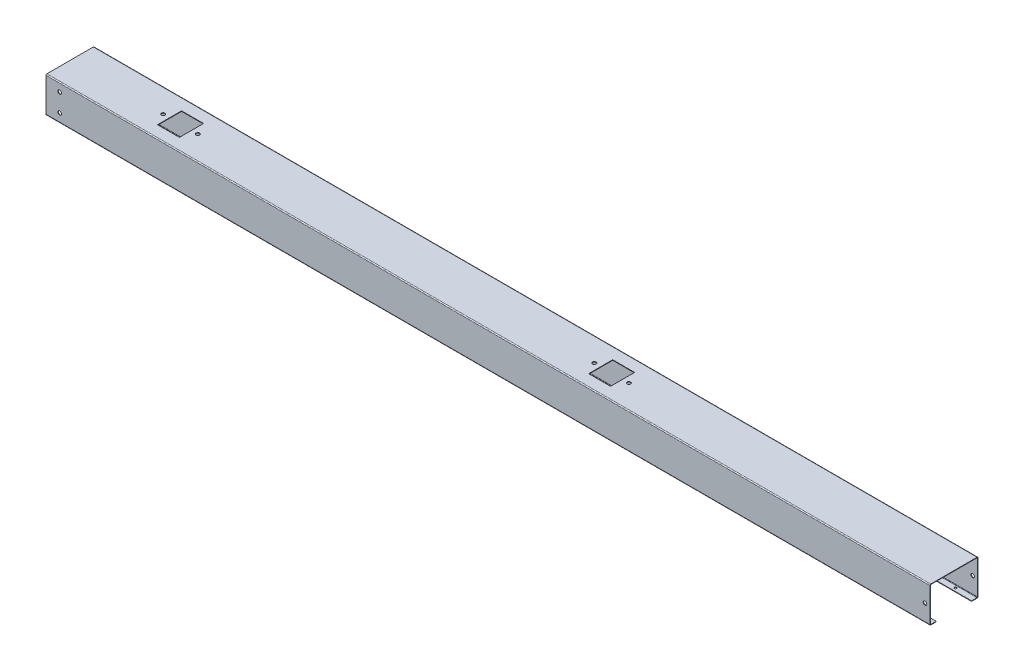
from build123d import *

# Parameters (mm, degrees)
SKETCH1_W                      = 1397
SKETCH1_H                      = 76.2
BASE_FLANGE1_DEPTH             = 0.75946
CUT_EXTRUDE1_DEPTH             = 10
SKETCH7_R                      = 2.8194
CUT_EXTRUDE2_DEPTH             = 10
EDGE_FLANGE1_STRIP_W           = 4.51104
EDGE_FLANGE1_STRIP_H           = 0.75946
EDGE_FLANGE1_STRIP_CUT_DEPTH   = 1397
EDGE_FLANGE1_STRIP_2_W         = 4.51104
EDGE_FLANGE1_STRIP_2_H         = 0.75946
EDGE_FLANGE1_STRIP_CUT_2_DEPTH = 1397
EDGE_FLANGE1_DEPTH             = 1397
EDGE_FLANGE1_BEND_DEPTH        = 1397
CUT_EXTRUDE5_DEPTH             = 831.856635277
CUT_EXTRUDE5_DEPTH_BACK        = 831.856635277
SKETCH43_R                     = 2.8194
EDGE_FLANGE5_STRIP_W           = 4.51104
EDGE_FLANGE5_STRIP_H           = 0.75946
EDGE_FLANGE5_STRIP_CUT_DEPTH   = 1397
EDGE_FLANGE5_STRIP_2_W         = 4.51104
EDGE_FLANGE5_STRIP_2_H         = 0.75946
EDGE_FLANGE5_STRIP_CUT_2_DEPTH = 1397
EDGE_FLANGE5_DEPTH             = 1397
EDGE_FLANGE5_BEND_DEPTH        = 1397
CUT_EXTRUDE6_REACH             = 830.283
SKETCH133_R                    = 1.651
CUT_EXTRUDE6_DIRECTION_2_DEPTH = 829.282923162
CUT_EXTRUDE7_DEPTH             = 831.907594623
CUT_EXTRUDE7_DEPTH_BACK        = 831.907594623
SKETCH134_R                    = 2.8194


# Sheet-metal steps are written as plain solids
with BuildPart() as part:
    # Sketch1 → Base-Flange1 (new body)
    with BuildSketch(Plane(origin=(0, 0, 0), x_dir=(1, 0, 0), z_dir=(0, 1, 0))):
        with Locations((127, 0)):
            Rectangle(SKETCH1_W, SKETCH1_H)
    extrude(amount=-BASE_FLANGE1_DEPTH)

    # Sketch6 → Cut-Extrude1 (cut)
    with BuildSketch(Plane(origin=(0, 0, 0), x_dir=(1, 0, 0), z_dir=(0, 1, 0))):
        Polygon((-414.3375, -19.05), (-390.7165, -19.05), (-379.6665, -19.05), (-379.6665, 19.05), (-390.7165, 19.05), (-414.3375, 19.05), align=None)
        Polygon((267.1445, -19.05), (290.7655, -19.05), (301.8155, -19.05), (301.8155, 19.05), (290.7655, 19.05), (267.1445, 19.05), align=None)
    extrude(amount=-CUT_EXTRUDE1_DEPTH, mode=Mode.SUBTRACT)

    # Sketch7 → Cut-Extrude2 (cut)
    with BuildSketch(Plane(origin=(0, 0, 0), x_dir=(1, 0, 0), z_dir=(0, 1, 0))):
        with Locations(Location((-424.3375054, 0, 0), (0, 0, 270))):
            Circle(SKETCH7_R)
        with Locations(Location((-369.6664946, 0, 0), (0, 0, 270))):
            Circle(SKETCH7_R)
        with Locations(Location((257.1444946, 0, 0), (0, 0, 270))):
            Circle(SKETCH7_R)
        with Locations(Location((311.8155054, 0, 0), (0, 0, 270))):
            Circle(SKETCH7_R)
    extrude(amount=-CUT_EXTRUDE2_DEPTH, mode=Mode.SUBTRACT)

    # Edge-Flange1 strip (across the edge) → Edge-Flange1 strip cut (cut)
    with BuildSketch(Plane(origin=(-571.5, -0.75946, -38.1), x_dir=(0, 0, 1), z_dir=(1, 0, 0))):
        with Locations((-0.75946, -0.37973)):
            Rectangle(EDGE_FLANGE1_STRIP_W, EDGE_FLANGE1_STRIP_H)
    extrude(amount=EDGE_FLANGE1_STRIP_CUT_DEPTH, mode=Mode.SUBTRACT)

    # Edge-Flange1 strip 2 (across the edge) → Edge-Flange1 strip cut 2 (cut)
    with BuildSketch(Plane(origin=(825.5, -0.75946, 38.1), x_dir=(0, 0, -1), z_dir=(-1, 0, 0))):
        with Locations((-0.75946, -0.37973)):
            Rectangle(EDGE_FLANGE1_STRIP_2_W, EDGE_FLANGE1_STRIP_2_H)
    extrude(amount=EDGE_FLANGE1_STRIP_CUT_2_DEPTH, mode=Mode.SUBTRACT)

    # Edge-Flange1 section (across the edge) → Edge-Flange1 (add)
    with BuildSketch(Plane(origin=(-571.5, -0.75946, -38.1), x_dir=(0, 0, 1), z_dir=(1, 0, 0))):
        with BuildLine():
            Line((0, 0.7366), (0, 54.61254))
            Line((0, 54.61254), (0.75946, 54.61254))
            Line((0.75946, 54.61254), (0.75946, 0.7366))
            ThreePointArc((0.75946, 0.7366), (0.975205145, 0.215745145), (1.49606, 0))
            Line((1.49606, 0), (1.49606, -0.75946))
            ThreePointArc((1.49606, -0.75946), (0.438185829, -0.321274171), (0, 0.7366))
        make_face()
    extrude(amount=EDGE_FLANGE1_DEPTH)

    # Edge-Flange1 section 2 (across the edge) → Edge-Flange1 bend (add)
    with BuildSketch(Plane(origin=(825.5, -0.75946, 38.1), x_dir=(0, 0, -1), z_dir=(-1, 0, 0))):
        with BuildLine():
            Line((0, 0.7366), (0, 54.61254))
            Line((0, 54.61254), (0.75946, 54.61254))
            Line((0.75946, 54.61254), (0.75946, 0.7366))
            ThreePointArc((0.75946, 0.7366), (0.975205145, 0.215745145), (1.49606, 0))
            Line((1.49606, 0), (1.49606, -0.75946))
            ThreePointArc((1.49606, -0.75946), (0.438185829, -0.321274171), (0, 0.7366))
        make_face()
    extrude(amount=EDGE_FLANGE1_BEND_DEPTH)

    # Sketch43 → Cut-Extrude5 (cut, two sides: drawn at the far end of the back side and taken through both)
    with BuildSketch(Plane(origin=(0, 0, -38.1), x_dir=(-1, 0, 0), z_dir=(0, 0, -1)).offset(-CUT_EXTRUDE5_DEPTH_BACK)):
        with Locations(Location((549.91, -13.44803, 0), (0, 0, 90))):
            Circle(SKETCH43_R)
        with Locations(Location((549.91, -42.164, 0), (0, 0, 90))):
            Circle(SKETCH43_R)
    extrude(amount=CUT_EXTRUDE5_DEPTH + CUT_EXTRUDE5_DEPTH_BACK, mode=Mode.SUBTRACT)

    # Edge-Flange5 strip (across the edge) → Edge-Flange5 strip cut (cut)
    with BuildSketch(Plane(origin=(825.5, -55.372, 37.34054), x_dir=(0, 1, 0), z_dir=(-1, 0, 0))):
        with Locations((-1.51892, -0.37973)):
            Rectangle(EDGE_FLANGE5_STRIP_W, EDGE_FLANGE5_STRIP_H)
    extrude(amount=EDGE_FLANGE5_STRIP_CUT_DEPTH, mode=Mode.SUBTRACT)

    # Edge-Flange5 strip 2 (across the edge) → Edge-Flange5 strip cut 2 (cut)
    with BuildSketch(Plane(origin=(-571.5, -55.372, -37.34054), x_dir=(0, 1, 0), z_dir=(1, 0, 0))):
        with Locations((-1.51892, -0.37973)):
            Rectangle(EDGE_FLANGE5_STRIP_2_W, EDGE_FLANGE5_STRIP_2_H)
    extrude(amount=EDGE_FLANGE5_STRIP_CUT_2_DEPTH, mode=Mode.SUBTRACT)

    # Edge-Flange5 section (across the edge) → Edge-Flange5 (add)
    with BuildSketch(Plane(origin=(825.5, -55.372, 37.34054), x_dir=(0, 1, 0), z_dir=(-1, 0, 0))):
        with BuildLine():
            Line((-0.75946, 0.7366), (-0.75946, 9.40054))
            Line((-0.75946, 9.40054), (0, 9.40054))
            Line((0, 9.40054), (0, 0.7366))
            ThreePointArc((0, 0.7366), (0.215745145, 0.215745145), (0.7366, 0))
            Line((0.7366, 0), (0.7366, -0.75946))
            ThreePointArc((0.7366, -0.75946), (-0.321274171, -0.321274171), (-0.75946, 0.7366))
        make_face()
    extrude(amount=EDGE_FLANGE5_DEPTH)

    # Edge-Flange5 section 2 (across the edge) → Edge-Flange5 bend (add)
    with BuildSketch(Plane(origin=(-571.5, -55.372, -37.34054), x_dir=(0, 1, 0), z_dir=(1, 0, 0))):
        with BuildLine():
            Line((-0.75946, 0.7366), (-0.75946, 9.40054))
            Line((-0.75946, 9.40054), (0, 9.40054))
            Line((0, 9.40054), (0, 0.7366))
            ThreePointArc((0, 0.7366), (0.215745145, 0.215745145), (0.7366, 0))
            Line((0.7366, 0), (0.7366, -0.75946))
            ThreePointArc((0.7366, -0.75946), (-0.321274171, -0.321274171), (-0.75946, 0.7366))
        make_face()
    extrude(amount=EDGE_FLANGE5_BEND_DEPTH)

    # Sketch133 → Cut-Extrude6 (cut, up to next)
    with BuildSketch(Plane.XZ.offset(56.13146), mode=Mode.PRIVATE) as cut_extrude6_sk1:
        with Locations(Location((698.5, -32.79394, 0), (0, 0, 90))):
            Circle(SKETCH133_R)
    cut_extrude6_tool1 = extrude(cut_extrude6_sk1.sketch, amount=-CUT_EXTRUDE6_REACH, mode=Mode.PRIVATE) & part.part
    # Sketch133 → Cut-Extrude6 (cut, up to next)
    with BuildSketch(Plane.XZ.offset(56.13146), mode=Mode.PRIVATE) as cut_extrude6_sk2:
        with Locations(Location((698.5, 32.79394, 0), (0, 0, 90))):
            Circle(SKETCH133_R)
    cut_extrude6_tool2 = extrude(cut_extrude6_sk2.sketch, amount=-CUT_EXTRUDE6_REACH, mode=Mode.PRIVATE) & part.part
    # Sketch133 → Cut-Extrude6 (cut, up to next)
    with BuildSketch(Plane.XZ.offset(56.13146), mode=Mode.PRIVATE) as cut_extrude6_sk3:
        with Locations(Location((201.93, 32.79394, 0), (0, 0, 90))):
            Circle(SKETCH133_R)
    cut_extrude6_tool3 = extrude(cut_extrude6_sk3.sketch, amount=-CUT_EXTRUDE6_REACH, mode=Mode.PRIVATE) & part.part
    # Sketch133 → Cut-Extrude6 (cut, up to next)
    with BuildSketch(Plane.XZ.offset(56.13146), mode=Mode.PRIVATE) as cut_extrude6_sk4:
        with Locations(Location((201.93, -32.79394, 0), (0, 0, 90))):
            Circle(SKETCH133_R)
    cut_extrude6_tool4 = extrude(cut_extrude6_sk4.sketch, amount=-CUT_EXTRUDE6_REACH, mode=Mode.PRIVATE) & part.part
    # Sketch133 → Cut-Extrude6 (cut, up to next)
    with BuildSketch(Plane.XZ.offset(56.13146), mode=Mode.PRIVATE) as cut_extrude6_sk5:
        with Locations(Location((-238.76, -32.79394, 0), (0, 0, 90))):
            Circle(SKETCH133_R)
    cut_extrude6_tool5 = extrude(cut_extrude6_sk5.sketch, amount=-CUT_EXTRUDE6_REACH, mode=Mode.PRIVATE) & part.part
    # Sketch133 → Cut-Extrude6 (cut, up to next)
    with BuildSketch(Plane.XZ.offset(56.13146), mode=Mode.PRIVATE) as cut_extrude6_sk6:
        with Locations(Location((-238.76, 32.79394, 0), (0, 0, 90))):
            Circle(SKETCH133_R)
    cut_extrude6_tool6 = extrude(cut_extrude6_sk6.sketch, amount=-CUT_EXTRUDE6_REACH, mode=Mode.PRIVATE) & part.part
    # Sketch133 → Cut-Extrude6 (cut, up to next)
    with BuildSketch(Plane.XZ.offset(56.13146), mode=Mode.PRIVATE) as cut_extrude6_sk7:
        with Locations(Location((-467.36, 32.79394, 0), (0, 0, 90))):
            Circle(SKETCH133_R)
    cut_extrude6_tool7 = extrude(cut_extrude6_sk7.sketch, amount=-CUT_EXTRUDE6_REACH, mode=Mode.PRIVATE) & part.part
    # Sketch133 → Cut-Extrude6 (cut, up to next)
    with BuildSketch(Plane.XZ.offset(56.13146), mode=Mode.PRIVATE) as cut_extrude6_sk8:
        with Locations(Location((-467.36, -32.79394, 0), (0, 0, 90))):
            Circle(SKETCH133_R)
    cut_extrude6_tool8 = extrude(cut_extrude6_sk8.sketch, amount=-CUT_EXTRUDE6_REACH, mode=Mode.PRIVATE) & part.part
    # Sketch133 → Cut-Extrude6 (cut, up to next)
    with BuildSketch(Plane.XZ.offset(56.13146), mode=Mode.PRIVATE) as cut_extrude6_sk9:
        with Locations(Location((-535.94, 32.79394, 0), (0, 0, 90))):
            Circle(SKETCH133_R)
    cut_extrude6_tool9 = extrude(cut_extrude6_sk9.sketch, amount=-CUT_EXTRUDE6_REACH, mode=Mode.PRIVATE) & part.part
    # Sketch133 → Cut-Extrude6 (cut, up to next)
    with BuildSketch(Plane.XZ.offset(56.13146), mode=Mode.PRIVATE) as cut_extrude6_sk10:
        with Locations(Location((-535.94, -32.79394, 0), (0, 0, 90))):
            Circle(SKETCH133_R)
    cut_extrude6_tool10 = extrude(cut_extrude6_sk10.sketch, amount=-CUT_EXTRUDE6_REACH, mode=Mode.PRIVATE) & part.part
    # Sketch133 → Cut-Extrude6 (cut, up to next)
    with BuildSketch(Plane.XZ.offset(56.13146), mode=Mode.PRIVATE) as cut_extrude6_sk11:
        with Locations(Location((795.02, 32.79394, 0), (0, 0, 90))):
            Circle(SKETCH133_R)
    cut_extrude6_tool11 = extrude(cut_extrude6_sk11.sketch, amount=-CUT_EXTRUDE6_REACH, mode=Mode.PRIVATE) & part.part
    # Sketch133 → Cut-Extrude6 (cut, up to next)
    with BuildSketch(Plane.XZ.offset(56.13146), mode=Mode.PRIVATE) as cut_extrude6_sk12:
        with Locations(Location((795.02, -32.79394, 0), (0, 0, 90))):
            Circle(SKETCH133_R)
    cut_extrude6_tool12 = extrude(cut_extrude6_sk12.sketch, amount=-CUT_EXTRUDE6_REACH, mode=Mode.PRIVATE) & part.part
    add(cut_extrude6_tool1.solids().sort_by_distance((698.5, -56.13146, -32.79394))[0], mode=Mode.SUBTRACT)
    add(cut_extrude6_tool2.solids().sort_by_distance((698.5, -56.13146, 32.79394))[0], mode=Mode.SUBTRACT)
    add(cut_extrude6_tool3.solids().sort_by_distance((201.93, -56.13146, 32.79394))[0], mode=Mode.SUBTRACT)
    add(cut_extrude6_tool4.solids().sort_by_distance((201.93, -56.13146, -32.79394))[0], mode=Mode.SUBTRACT)
    add(cut_extrude6_tool5.solids().sort_by_distance((-238.76, -56.13146, -32.79394))[0], mode=Mode.SUBTRACT)
    add(cut_extrude6_tool6.solids().sort_by_distance((-238.76, -56.13146, 32.79394))[0], mode=Mode.SUBTRACT)
    add(cut_extrude6_tool7.solids().sort_by_distance((-467.36, -56.13146, 32.79394))[0], mode=Mode.SUBTRACT)
    add(cut_extrude6_tool8.solids().sort_by_distance((-467.36, -56.13146, -32.79394))[0], mode=Mode.SUBTRACT)
    add(cut_extrude6_tool9.solids().sort_by_distance((-535.94, -56.13146, 32.79394))[0], mode=Mode.SUBTRACT)
    add(cut_extrude6_tool10.solids().sort_by_distance((-535.94, -56.13146, -32.79394))[0], mode=Mode.SUBTRACT)
    add(cut_extrude6_tool11.solids().sort_by_distance((795.02, -56.13146, 32.79394))[0], mode=Mode.SUBTRACT)
    add(cut_extrude6_tool12.solids().sort_by_distance((795.02, -56.13146, -32.79394))[0], mode=Mode.SUBTRACT)

    # Sketch133 → Cut-Extrude6 direction 2 (cut)
    with BuildSketch(Plane.XZ.offset(56.13146)):
        with Locations(Location((698.5, -32.79394, 0), (0, 0, 90))):
            Circle(SKETCH133_R)
        with Locations(Location((698.5, 32.79394, 0), (0, 0, 90))):
            Circle(SKETCH133_R)
        with Locations(Location((201.93, 32.79394, 0), (0, 0, 90))):
            Circle(SKETCH133_R)
        with Locations(Location((201.93, -32.79394, 0), (0, 0, 90))):
            Circle(SKETCH133_R)
        with Locations(Location((-238.76, -32.79394, 0), (0, 0, 90))):
            Circle(SKETCH133_R)
        with Locations(Location((-238.76, 32.79394, 0), (0, 0, 90))):
            Circle(SKETCH133_R)
        with Locations(Location((-467.36, 32.79394, 0), (0, 0, 90))):
            Circle(SKETCH133_R)
        with Locations(Location((-467.36, -32.79394, 0), (0, 0, 90))):
            Circle(SKETCH133_R)
        with Locations(Location((-535.94, 32.79394, 0), (0, 0, 90))):
            Circle(SKETCH133_R)
        with Locations(Location((-535.94, -32.79394, 0), (0, 0, 90))):
            Circle(SKETCH133_R)
        with Locations(Location((795.02, 32.79394, 0), (0, 0, 90))):
            Circle(SKETCH133_R)
        with Locations(Location((795.02, -32.79394, 0), (0, 0, 90))):
            Circle(SKETCH133_R)
    extrude(amount=CUT_EXTRUDE6_DIRECTION_2_DEPTH, mode=Mode.SUBTRACT)

    # Sketch134 → Cut-Extrude7 (cut, two sides: drawn at the far end of the back side and taken through both)
    with BuildSketch(Plane(origin=(0, 0, -38.1), x_dir=(-1, 0, 0), z_dir=(0, 0, -1)).offset(-CUT_EXTRUDE7_DEPTH_BACK)):
        with Locations(Location((-817.88, -29.21, 0), (0, 0, 90))):
            Circle(SKETCH134_R)
    extrude(amount=CUT_EXTRUDE7_DEPTH + CUT_EXTRUDE7_DEPTH_BACK, mode=Mode.SUBTRACT)


solid = part.part
